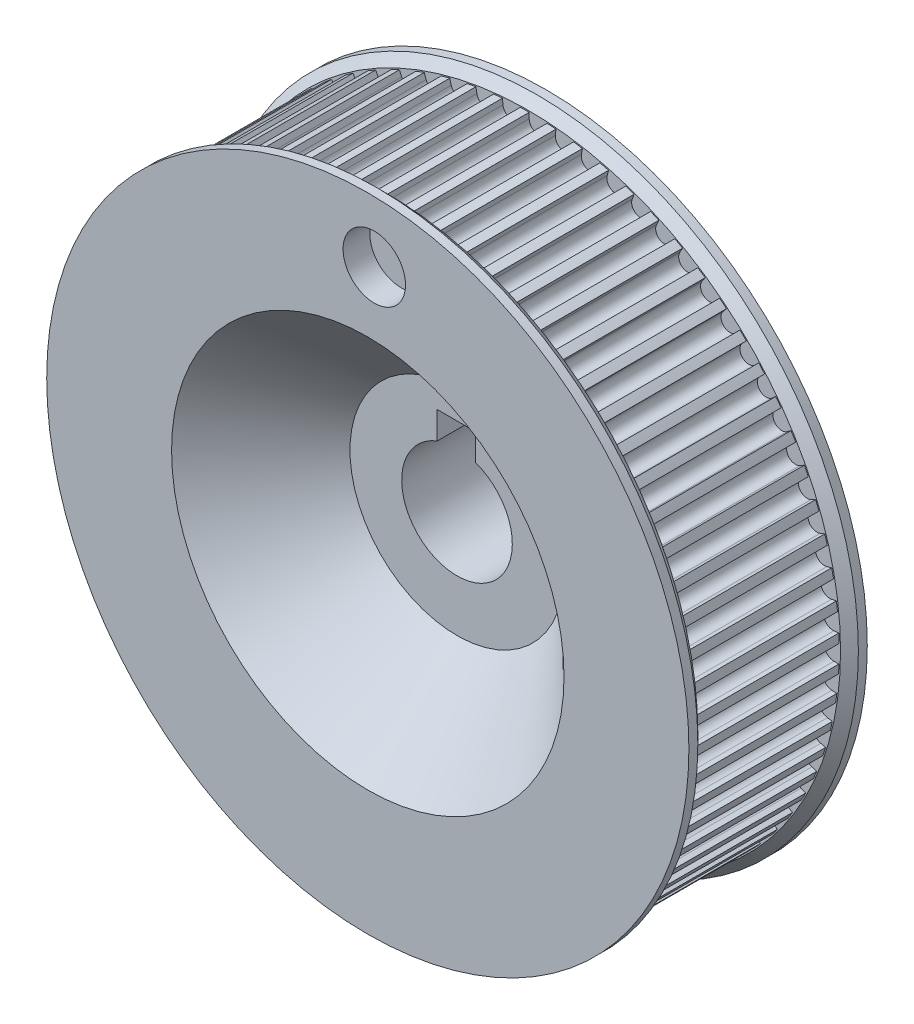
from build123d import *

# Parameters (mm, degrees)
SKETCH1_R                = 12
BOSS_EXTRUDE1_DEPTH      = 28
SKETCH2_R                = 6.2
CUT_EXTRUDE1_DEPTH       = 60
SKETCH4_R                = 34.85
SKETCH4_R_2              = 10
BOSS_EXTRUDE2_DEPTH      = 17
CUT_EXTRUDE3_DEPTH       = 18
CIRPATTERN1_COUNT        = 73
SKETCH7_R                = 36
SKETCH7_R_2              = 7
BOSS_EXTRUDE3_DEPTH      = 2
LPATTERN1_COUNT          = 2
LPATTERN1_PITCH          = 18
CHAMFER1_SIZE            = 1
CUT_EXTRUDE2_DEPTH       = 10
CUT_EXTRUDE2_DEPTH_BACK  = 1
SKETCH5_R                = 3.5
SKETCH8_W                = 4.297164599
SKETCH8_H                = 3.437731679
CUT_EXTRUDE4_DEPTH       = 100
CUT_EXTRUDE5_START       = -10
SKETCH9_R                = 12
CUT_EXTRUDE5_DEPTH       = 10
CHAMFER2_SIZE            = 10
CHAMFER3_SIZE            = 2
CHAMFER4_SIZE            = 1
CHAMFER5_SIZE            = 1
SKETCH10_R               = 7
CUT_EXTRUDE6_DEPTH       = 15
FILLET1_R                = 2
CIRPATTERN2_COUNT        = 8
FILLET1_OF_CIRPATTERN2_R = 2


with BuildPart() as part:
    # Sketch1 → Boss-Extrude1 (new body)
    with BuildSketch(Plane.XY):
        Circle(SKETCH1_R)
    extrude(amount=BOSS_EXTRUDE1_DEPTH)

    # Sketch2 → Cut-Extrude1 (cut)
    with BuildSketch(Plane.XY.offset(28)):
        Circle(SKETCH2_R)
    extrude(amount=-CUT_EXTRUDE1_DEPTH, mode=Mode.SUBTRACT)

    # Sketch4 → Boss-Extrude2 (add)
    with BuildSketch(Plane.XY.offset(28)):
        Circle(SKETCH4_R)
        Circle(SKETCH4_R_2, mode=Mode.SUBTRACT)
    extrude(amount=-BOSS_EXTRUDE2_DEPTH)

    # Sketch6 → Cut-Extrude3 (cut)
    with BuildSketch(Plane.XY.offset(28)):
        with BuildLine():
            Line((2.095100681, 35.489561228), (2.095100681, 34.226509354))
            ThreePointArc((2.095100681, 34.226509354), (1.095100681, 33.226509354), (0.095100681, 34.226509354))
            Line((0.095100681, 34.226509354), (0.095100681, 35.489561228))
            ThreePointArc((0.095100681, 35.489561228), (1.095100681, 36.489561228), (2.095100681, 35.489561228))
        make_face()
    cut_extrude3 = extrude(amount=-CUT_EXTRUDE3_DEPTH, mode=Mode.SUBTRACT)

    # CirPattern1: Cut-Extrude3 ×73 about axis
    cirpattern1_axis = Axis((0, 0, 0), (0, 0, 1))
    for i in range(1, CIRPATTERN1_COUNT):
        add(cut_extrude3.rotate(cirpattern1_axis, i * 360 / CIRPATTERN1_COUNT), mode=Mode.SUBTRACT)

    # Sketch7 → Boss-Extrude3 (add)
    with BuildSketch(Plane.XY.offset(28)):
        Circle(SKETCH7_R)
        Circle(SKETCH7_R_2, mode=Mode.SUBTRACT)
    boss_extrude3 = extrude(amount=BOSS_EXTRUDE3_DEPTH)

    # LPattern1: Boss-Extrude3 ×2
    with Locations(*[(0, 0, -i * LPATTERN1_PITCH) for i in range(1, LPATTERN1_COUNT)]):
        add(boss_extrude3)

    # Chamfer1
    chamfer1_edges = [part.edges().sort_by_distance(p)[0] for p in [
        (-36, 0, 28),
        (-36, 0, 12),
    ]]
    chamfer(chamfer1_edges, length=CHAMFER1_SIZE)

    # Sketch5 → Cut-Extrude2 (cut, two sides: drawn at the far end of the back side and taken through both)
    with BuildSketch(Plane.XY.offset(28).offset(-CUT_EXTRUDE2_DEPTH_BACK)):
        with Locations((0.724287197, 29.141908403)):
            Circle(SKETCH5_R)
    extrude(amount=CUT_EXTRUDE2_DEPTH + CUT_EXTRUDE2_DEPTH_BACK, mode=Mode.SUBTRACT)

    # Sketch8 → Cut-Extrude4 (cut)
    with BuildSketch(Plane(origin=(0, 0, 0), x_dir=(-1, 0, 0), z_dir=(0, 0, -1))):
        with Locations((0.067849967, 7.124246572)):
            Rectangle(SKETCH8_W, SKETCH8_H)
    extrude(amount=-CUT_EXTRUDE4_DEPTH, mode=Mode.SUBTRACT)

    # Sketch9 → Cut-Extrude5 (cut)
    with BuildSketch(Plane.XY.offset(30).offset(CUT_EXTRUDE5_START)):
        Circle(SKETCH9_R)
    extrude(amount=CUT_EXTRUDE5_DEPTH, mode=Mode.SUBTRACT)

    # Chamfer2
    chamfer2_edges = [part.edges().sort_by_distance(p)[0] for p in [
        (-12, 0, 30),
    ]]
    chamfer(chamfer2_edges, length=CHAMFER2_SIZE - 0.0001)  # a hair under: the kernel refuses the full size

    # Chamfer3
    chamfer3_edges = [part.edges().sort_by_distance(p)[0] for p in [
        (-12, 0, 10),
    ]]
    chamfer(chamfer3_edges, length=CHAMFER3_SIZE)

    # Chamfer4
    chamfer4_edges = [part.edges().sort_by_distance(p)[0] for p in [
        (0.072332835, -6.199578047, 0),
    ]]
    chamfer(chamfer4_edges, length=CHAMFER4_SIZE)

    # Chamfer5
    chamfer5_edges = [part.edges().sort_by_distance(p)[0] for p in [
        (-12, 0, 0),
    ]]
    chamfer(chamfer5_edges, length=CHAMFER5_SIZE)

    # Sketch10 → Cut-Extrude6 (cut)
    with BuildSketch(Plane(origin=(0, 0, 10), x_dir=(-1, 0, 0), z_dir=(0, 0, -1))):
        with Locations((1.551059843, 24.769366816)):
            Circle(SKETCH10_R)
    cut_extrude6 = extrude(amount=-CUT_EXTRUDE6_DEPTH, mode=Mode.SUBTRACT)

    # Fillet1
    fillet1_edges = [part.edges().sort_by_distance(p)[0] for p in [
        (5.448940157, 24.769366816, 10),
    ]]
    fillet(fillet1_edges, radius=FILLET1_R)

    # CirPattern2: Cut-Extrude6 ×8 about axis
    cirpattern2_axis = Axis((0, 0, 0), (0, 0, 1))
    for i in range(1, CIRPATTERN2_COUNT):
        add(cut_extrude6.rotate(cirpattern2_axis, i * 360 / CIRPATTERN2_COUNT), mode=Mode.SUBTRACT)

    # Fillet1 of CirPattern2
    fillet1_of_cirpattern2_edges = [part.edges().sort_by_distance(p)[0] for p in [
        (-13.661604706, 21.367569776, 10),
        (-24.769366816, 5.448940157, 10),
        (-21.367569776, -13.661604706, 10),
        (-5.448940157, -24.769366816, 10),
        (13.661604706, -21.367569776, 10),
        (24.769366816, -5.448940157, 10),
        (21.367569776, 13.661604706, 10),
    ]]
    fillet(fillet1_of_cirpattern2_edges, radius=FILLET1_OF_CIRPATTERN2_R)


solid = part.part
